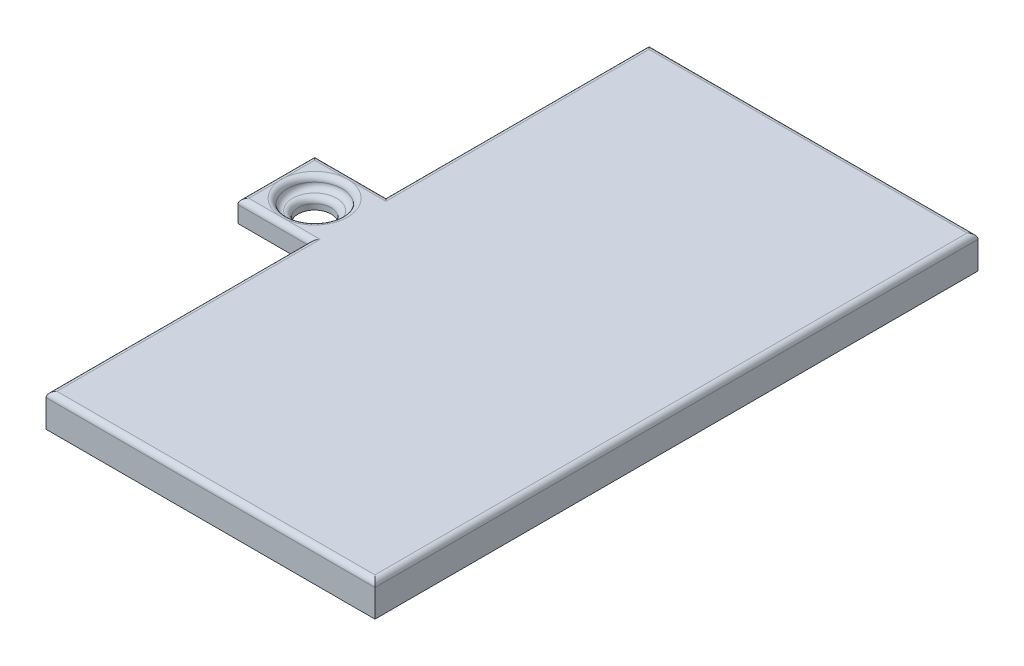
from build123d import *

# Parameters (mm, degrees)
SKETCH1_W           = 30
SKETCH1_H           = 55
BOSS_EXTRUDE1_DEPTH = 3
SKETCH2_W           = 7
SKETCH2_H           = 7
BOSS_EXTRUDE2_DEPTH = 2
SKETCH3_R           = 1.5
CUT_EXTRUDE1_DEPTH  = 2
SKETCH4_R           = 2.5
CUT_EXTRUDE2_DEPTH  = 1
FILLET2_R           = 0.5


with BuildPart() as part:
    # Sketch1 → Boss-Extrude1 (new body)
    with BuildSketch(Plane(origin=(0, 0, 0), x_dir=(1, 0, 0), z_dir=(0, 1, 0))):
        Rectangle(SKETCH1_W, SKETCH1_H)
    extrude(amount=BOSS_EXTRUDE1_DEPTH)

    # Sketch2 → Boss-Extrude2 (add)
    with BuildSketch(Plane(origin=(0, 3, 0), x_dir=(1, 0, 0), z_dir=(0, 1, 0))):
        with Locations((-18, 0)):
            Rectangle(SKETCH2_W, SKETCH2_H)
    extrude(amount=-BOSS_EXTRUDE2_DEPTH)

    # Sketch3 → Cut-Extrude1 (cut)
    with BuildSketch(Plane(origin=(0, 3, 0), x_dir=(1, 0, 0), z_dir=(0, 1, 0))):
        with Locations(Location((-18, 0, 0), (0, 0, 270))):
            Circle(SKETCH3_R)
    extrude(amount=-CUT_EXTRUDE1_DEPTH, mode=Mode.SUBTRACT)

    # Sketch4 → Cut-Extrude2 (cut)
    with BuildSketch(Plane(origin=(0, 3, 0), x_dir=(1, 0, 0), z_dir=(0, 1, 0))):
        with Locations(Location((-18, 0, 0), (0, 0, 270))):
            Circle(SKETCH4_R)
    extrude(amount=-CUT_EXTRUDE2_DEPTH, mode=Mode.SUBTRACT)

    # Fillet2
    fillet2_edges = [part.edges().sort_by_distance(p)[0] for p in [
        (15, 3, 0),
        (-15, 3, 15.5),
        (-18.25, 3, 3.5),
        (0, 3, -27.5),
        (-18.25, 3, -3.5),
        (-21.5, 3, 0),
        (-18, 3, -2.5),
        (-18, 2, -2.5),
        (-18, 2, -1.5),
        (-15, 3, -15.5),
        (0, 3, 27.5),
    ]]
    fillet(fillet2_edges, radius=FILLET2_R - 0.0001)  # a hair under: the kernel refuses the full size


solid = part.part
